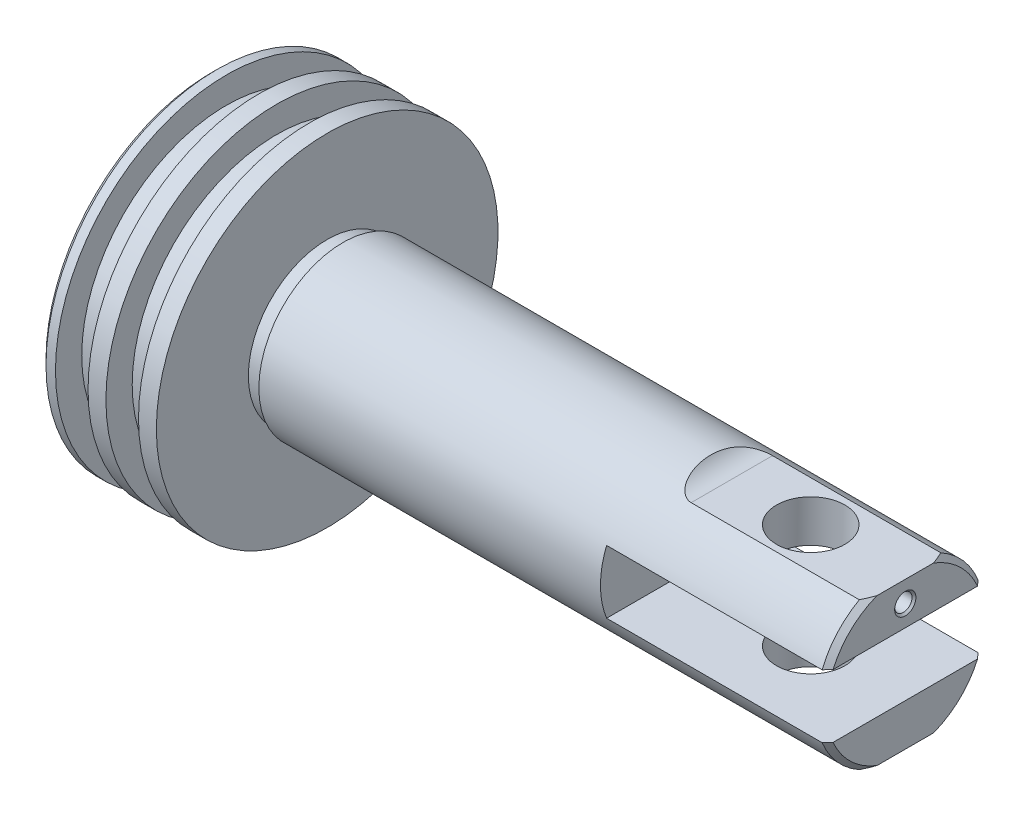
from build123d import *

# Parameters (mm, degrees)
CHAMFER_2_SIZE           = 1
CHAMFER_1_SIZE           = 1
CUT_EXTRUDE_1_DEPTH      = 140.773030303
CUT_EXTRUDE_1_DEPTH_BACK = 140.773030303
SKETCH_2_W               = 45.54274113
SKETCH_2_H               = 12
SKETCH_3_OUTSIDE_W       = 99.17
SKETCH_3_OUTSIDE_H       = 99.17
SKETCH_3_OUTSIDE_W_2     = 70.7839493
SKETCH_3_OUTSIDE_H_2     = 28
CUT_EXTRUDE_1_2_DEPTH    = 38
FILLET_1_R               = 5
SKETCH_4_R               = 6.5
CUT_EXTRUDE_2_DEPTH      = 38


# Read off the part's stored shape, not the designer's step: M4 螺纹孔1
with BuildPart() as part:
    # 草图1 → 旋转1 (revolve)
    with BuildSketch(Plane.XY, mode=Mode.PRIVATE) as revolve_1_sk:
        Polygon((0, 0), (0, 32.5), (2.8, 32.5), (2.8, 27.5), (9, 27.5), (9, 32.5), (12.4, 32.5), (12.4, 27.5), (18.6, 27.5), (18.6, 32.5), (22, 32.5), (22, 15), (25, 15), (25, 16), (132, 16), (132, 0), align=None)
    revolve(revolve_1_sk.sketch.rotate(Axis((0, 0, 0), (1, 0, 0)), 90), axis=Axis((0, 0, 0), (1, 0, 0)))

    # 倒角2
    chamfer_2_edges = [part.edges().sort_by_distance(p)[0] for p in [
        (132, 0, -16),
    ]]
    chamfer(chamfer_2_edges, length=CHAMFER_2_SIZE)

    # 倒角1
    chamfer_1_edges = [part.edges().sort_by_distance(p)[0] for p in [
        (0, 0, -32.5),
    ]]
    chamfer(chamfer_1_edges, length=CHAMFER_1_SIZE)

    # 草图2 → Cut-Extrude 1 (cut, two sides: drawn at the far end of the back side and taken through both)
    with BuildSketch(Plane.XY.offset(-CUT_EXTRUDE_1_DEPTH_BACK)):
        with Locations((112.771370565, 0)):
            Rectangle(SKETCH_2_W, SKETCH_2_H)
    extrude(amount=CUT_EXTRUDE_1_DEPTH + CUT_EXTRUDE_1_DEPTH_BACK, mode=Mode.SUBTRACT)

    # 草图3 outside → Cut-Extrude 1 2 (cut)
    with BuildSketch(Plane(origin=(132, 0, 0), x_dir=(0, 0, -1), z_dir=(1, 0, 0))):
        Rectangle(SKETCH_3_OUTSIDE_W, SKETCH_3_OUTSIDE_H)
        Rectangle(SKETCH_3_OUTSIDE_W_2, SKETCH_3_OUTSIDE_H_2, mode=Mode.SUBTRACT)
    extrude(amount=-CUT_EXTRUDE_1_2_DEPTH, mode=Mode.SUBTRACT)

    # 圆角1
    # the kernel refuses this fillet: 5 mm, written as the material it adds along each edge
    with BuildSketch(Plane(origin=(94, -14, 20.245966692), x_dir=(1, 0, 0), z_dir=(0, 0, -1))) as fillet_1_piece_1_section:
        with BuildLine():
            CenterArc((FILLET_1_R, FILLET_1_R), FILLET_1_R, 180, 90)
            Line((0, FILLET_1_R), (0, 0))
            Line((0, 0), (FILLET_1_R, 0))
        make_face()
    fillet_1_piece_1 = extrude(amount=40.491933385, mode=Mode.PRIVATE)
    fillet_1_piece_1 = fillet_1_piece_1 & Plane(origin=(95.499656212, 0, 0), x_dir=(0, 0, 1), z_dir=(1, 0, 0)) * Cylinder(16, 101, mode=Mode.PRIVATE)
    add(fillet_1_piece_1)
    with BuildSketch(Plane(origin=(94, 14, -20.245966692), x_dir=(1, 0, 0), z_dir=(0, 0, 1))) as fillet_1_piece_2_section:
        with BuildLine():
            CenterArc((FILLET_1_R, FILLET_1_R), FILLET_1_R, 180, 90)
            Line((0, FILLET_1_R), (0, 0))
            Line((0, 0), (FILLET_1_R, 0))
        make_face()
    fillet_1_piece_2 = extrude(amount=40.491933385, mode=Mode.PRIVATE)
    fillet_1_piece_2 = fillet_1_piece_2 & Plane(origin=(95.499656212, 0, 0), x_dir=(0, 0, 1), z_dir=(1, 0, 0)) * Cylinder(16, 101, mode=Mode.PRIVATE)
    add(fillet_1_piece_2)

    # 草图4 → 切除-拉伸2 (cut)
    with BuildSketch(Plane(origin=(0, 14, 0), x_dir=(1, 0, 0), z_dir=(0, 1, 0))):
        with Locations(Location((114, 0, 0), (0, 0, 180))):
            Circle(SKETCH_4_R)
    extrude(amount=-CUT_EXTRUDE_2_DEPTH, mode=Mode.SUBTRACT)

    # M4 螺纹孔1 outline → M4 螺纹孔1 (revolve, cut)
    with BuildSketch(Plane(origin=(0, 10, 0), x_dir=(0, 1, 0), z_dir=(0, 0, -1))):
        Polygon((0, 120.286969782), (1.65, 120.286969782), (1.65, 131.625), (2.025, 132), (0, 132), align=None)
    revolve(axis=Axis((0, 10, 0), (1, 0, 0)), mode=Mode.SUBTRACT)


solid = part.part
